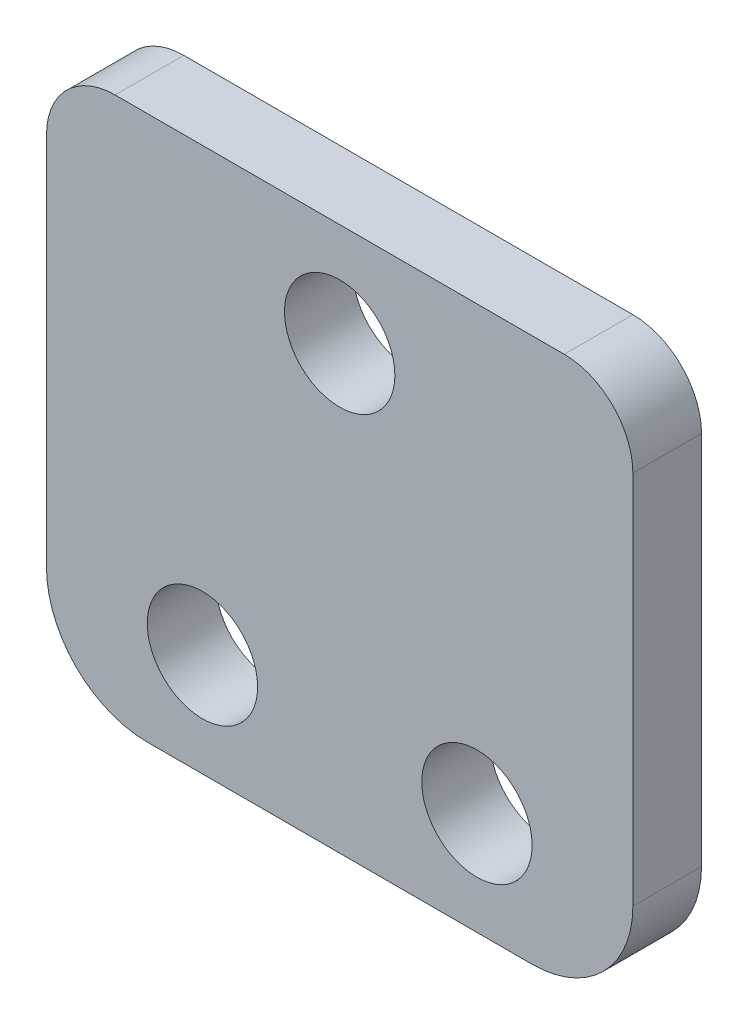
from build123d import *

# Parameters (mm, degrees)
BOSS_EXTRUDE1_DEPTH    = 3.175
F_10_CLEARANCE_HOLE1_D = 5.1054


with BuildPart() as part:
    # Sketch1 → Boss-Extrude1 (new body)
    with BuildSketch(Plane.XY):
        with BuildLine():
            ThreePointArc((8.9027, -4.6609), (12.198453996, -3.295753996), (13.5636, 0))
            Line((13.5636, 0), (13.5636, 17.3482))
            ThreePointArc((13.5636, 17.3482), (12.63366403, 19.59326403), (10.3886, 20.5232))
            Line((10.3886, 20.5232), (-10.3886, 20.5232))
            ThreePointArc((-10.3886, 20.5232), (-12.63366403, 19.59326403), (-13.5636, 17.3482))
            Line((-13.5636, 17.3482), (-13.5636, 0))
            ThreePointArc((-13.5636, 0), (-12.198453996, -3.295753996), (-8.9027, -4.6609))
            Line((-8.9027, -4.6609), (8.9027, -4.6609))
        make_face()
    extrude(amount=BOSS_EXTRUDE1_DEPTH)

    # #10 Clearance Hole1 (through all)
    with Locations(Plane.XY.offset(3.175)):
        with Locations((6.35, 0.1016), (-6.35, 0.1016), (0, 15.7607)):
            Hole(F_10_CLEARANCE_HOLE1_D / 2)


solid = part.part
